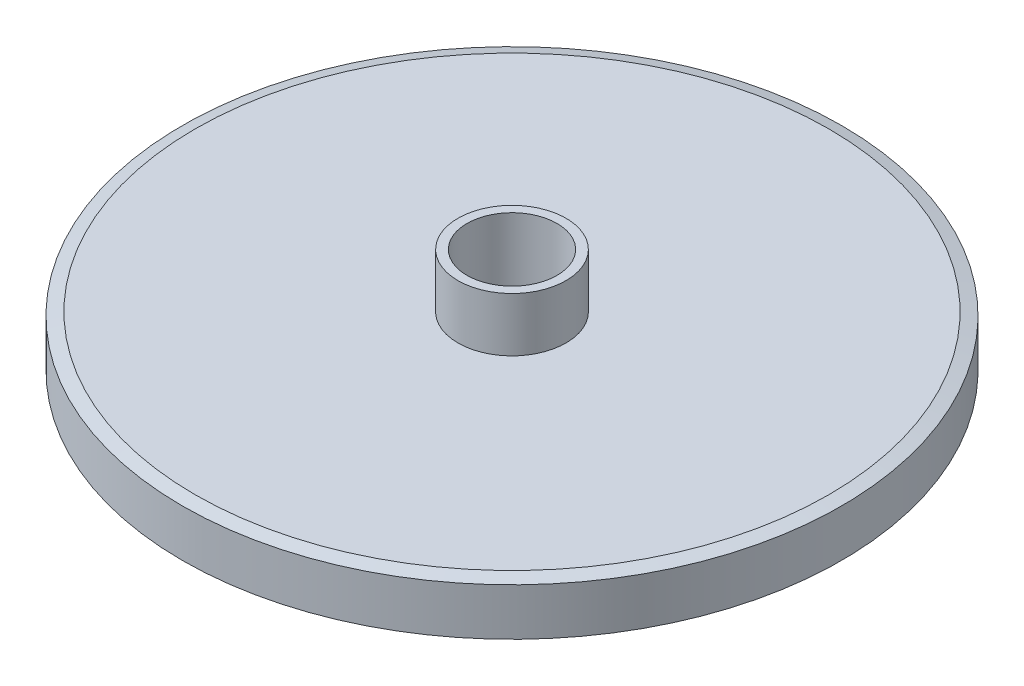
from build123d import *

# Parameters (mm, degrees)
CHAMFER_1_SIZE           = 0.705
CHAMFER_1_SIZE2          = 0.188904181
CUT_EXTRUDE_3_DEPTH      = 27.566520284
CUT_EXTRUDE_3_DEPTH_BACK = 27.566520284
SKETCH_2_R               = 2.5
CHAMFER_2_SIZE           = 0.705
CHAMFER_2_SIZE2          = 0.188904181


with BuildPart() as part:
    # Эскиз1 → Повернуть2 (revolve)
    with BuildSketch(Plane.XY):
        Polygon((0, 0), (18.3, 0), (18.3, 3), (3, 3), (3, 6), (0, 6), align=None)
    revolve(axis=Axis((0, 6, 0), (0, -1, 0)))

    # Фаска1
    chamfer_1_edges = [part.edges().sort_by_distance(p)[0] for p in [
        (-18.3, 3, 0),
    ]]
    chamfer_1_side = [part.faces().sort_by_distance(p)[0] for p in [
        (-17.782397836, 3, 0),
    ]]
    chamfer(chamfer_1_edges, length=CHAMFER_1_SIZE, length2=CHAMFER_1_SIZE2, reference=chamfer_1_side[0])

    # Эскиз2 → Вырез-Вытянуть3 (cut, two sides: drawn at the far end of the back side and taken through both)
    with BuildSketch(Plane(origin=(0, 0, 0), x_dir=(-1, 0, 0), z_dir=(0, -1, 0)).offset(-CUT_EXTRUDE_3_DEPTH_BACK)):
        Circle(SKETCH_2_R)
    extrude(amount=CUT_EXTRUDE_3_DEPTH + CUT_EXTRUDE_3_DEPTH_BACK, mode=Mode.SUBTRACT)

    # Фаска2
    chamfer_2_edges = [part.edges().sort_by_distance(p)[0] for p in [
        (-18.3, 0, 0),
    ]]
    chamfer_2_side = [part.faces().sort_by_distance(p)[0] for p in [
        (-17.782397836, 0, 0),
    ]]
    chamfer(chamfer_2_edges, length=CHAMFER_2_SIZE, length2=CHAMFER_2_SIZE2, reference=chamfer_2_side[0])


solid = part.part
